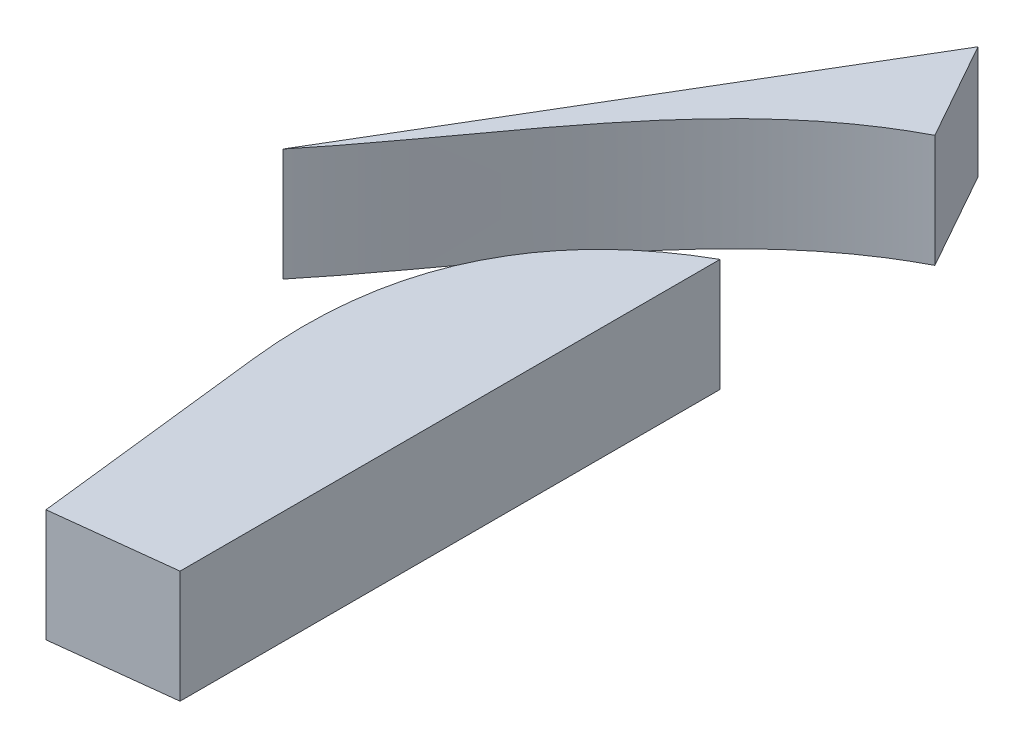
from build123d import *

# Parameters (mm, degrees)
BOSS_EXTRUDE1_DEPTH   = 10
BOSS_EXTRUDE1_2_DEPTH = 10


with BuildPart() as part:
    # Sketch1 → Boss-Extrude1 (new body)
    with BuildSketch(Plane(origin=(0, 0, 0), x_dir=(1, 0, 0), z_dir=(0, 1, 0))):
        with BuildLine():
            Line((5.085905806, -12.113248654), (5.085905806, -40.48083774))
            Line((5.085905806, -40.48083774), (5.085905806, -60.038229021))
            Line((5.085905806, -60.038229021), (-5.580262599, -61.269377976))
            Line((-5.580262599, -61.269377976), (-7.979792461, -40.48083774))
            add(Edge.make_bspline(
                [(-7.979792461, -40.48083774), (-9.484162723, -27.447592255), (-5.158932637, -17.915895662), (5.085905806, -12.113248654)],
                knots=[0, 0, 0, 0, 1, 1, 1, 1], degree=3))
        make_face()
    extrude(amount=BOSS_EXTRUDE1_DEPTH)


with BuildPart() as body_2:
    # Sketch1 → Boss-Extrude1 2 (new body)
    with BuildSketch(Plane(origin=(0, 0, 0), x_dir=(1, 0, 0), z_dir=(0, 1, 0))):
        with BuildLine():
            Line((0.192780278, 15.675645482), (-22.784752272, -23.015865188))
            add(Edge.make_bspline(
                [(-22.784752272, -23.015865188), (-14.132330383, -12.509142706), (-7.483851587, 0.438819743), (5.085905806, 6.95456054)],
                knots=[0, 0, 0, 0, 1, 1, 1, 1], degree=3))
            Line((5.085905806, 6.95456054), (0.192780278, 15.675645482))
        make_face()
    extrude(amount=BOSS_EXTRUDE1_2_DEPTH)


solid = Compound([part.part, body_2.part])
